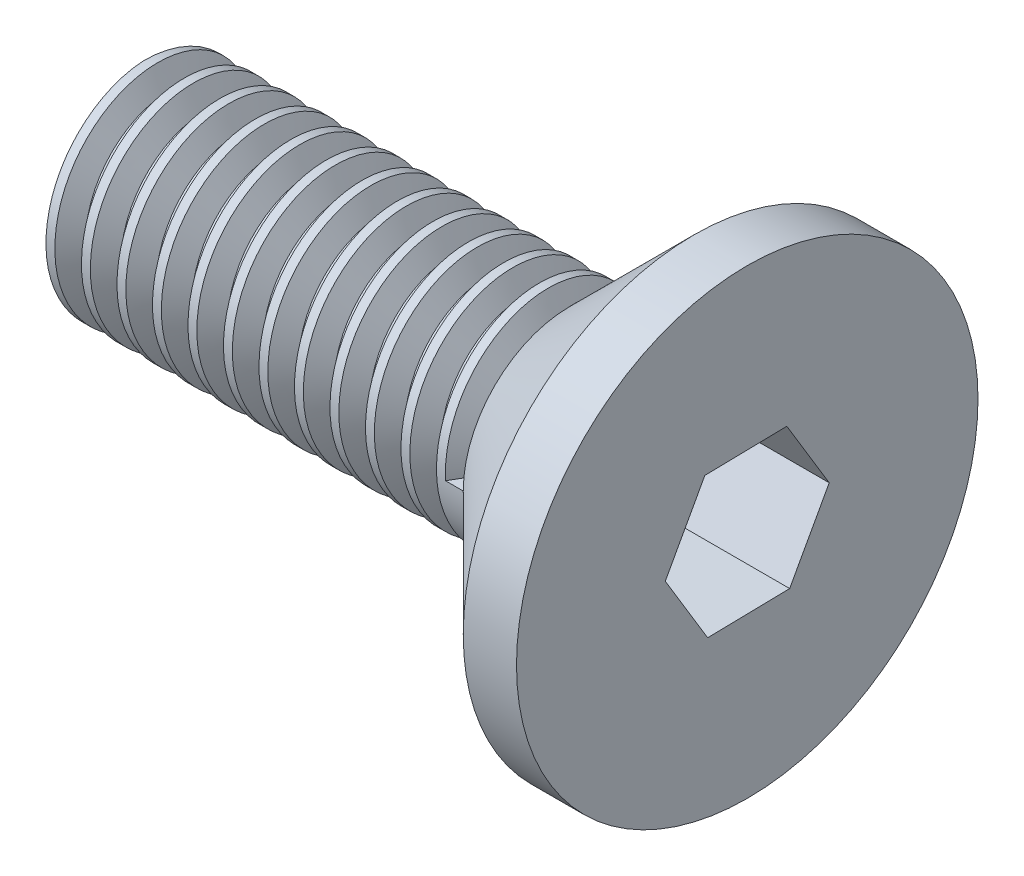
from build123d import *

# Parameters (mm, degrees)
CORTE_EXTRUS_O1_DEPTH = 4
ROSCA1_PITCH          = 1
CORTE_EXTRUS_O2_START = -1
ESBO_O22_R            = 3
CORTE_EXTRUS_O2_DEPTH = 1


with BuildPart() as part:
    # Esboço1 → Revolução1 (revolve)
    with BuildSketch(Plane(origin=(0, 0, 0), x_dir=(1, 0, 0), z_dir=(0, 1, 0))):
        Polygon((0, 0), (0, 3), (13, 3), (16.5, 6.5), (18, 6.5), (18, 0), align=None)
    revolve(axis=Axis((18, 0, 0), (-1, 0, 0)))

    # Esboço2 → Corte-extrusão1 (cut)
    with BuildSketch(Plane(origin=(18, 0, 0), x_dir=(0, 0, -1), z_dir=(1, 0, 0))):
        Polygon((-1.194677596, 1.97638022), (-2.308934276, -0.046431037), (-1.11425668, -2.022811258), (1.194677596, -1.97638022), (2.308934276, 0.046431037), (1.11425668, 2.022811258), align=None)
    extrude(amount=-CORTE_EXTRUS_O1_DEPTH, mode=Mode.SUBTRACT)

    # Rosca1: the profile of Perfil da rosca1 profile screwed along a right-hand helix of 12.5 turns, 8 arcs to a turn; built about Z, then put on its axis
    rosca1_z = Axis((0, 0, 0), (0, 0, 1))
    rosca1_corners = [(3.0003, 0, -0.000173205), (2.458734125, 0, 0.312499999), (2.458734125, 0, 0.437499999), (3.0003, 0, 0.750173202)]
    with BuildLine(mode=Mode.PRIVATE) as rosca1_profile:
        Line(rosca1_corners[0], rosca1_corners[1])
        Line(rosca1_corners[1], rosca1_corners[2])
        Line(rosca1_corners[2], rosca1_corners[3])
        Line(rosca1_corners[3], rosca1_corners[0])
    rosca1_cap = Face(rosca1_profile.wire())
    rosca1_turn_angles = [0, 22.5, 45, 67.5, 90, 112.5, 135, 157.5, 180, 202.5, 225, 247.5, 270, 292.5, 315, 337.5, 360]
    rosca1_turn_weights = [1, 0.9238795325112867, 1, 0.9238795325112867, 1, 0.9238795325112867, 1, 0.9238795325112867, 1, 0.9238795325112867, 1, 0.9238795325112867, 1, 0.9238795325112867, 1, 0.9238795325112867, 1]
    rosca1_turn_rails = [Edge.make_bspline([Vector(p[0], p[1], 0).rotate(rosca1_z, rosca1_turn_angles[k]) / rosca1_turn_weights[k] + Vector(0, 0, p[2] + ROSCA1_PITCH * rosca1_turn_angles[k] / 360) for k in range(17)], [0, 0, 0, 1, 1, 2, 2, 3, 3, 4, 4, 5, 5, 6, 6, 7, 7, 8, 8, 8], 2, rosca1_turn_weights) for p in rosca1_corners]
    rosca1_turn_sides = [Face.make_surface_from_curves(rosca1_turn_rails[p[0]], rosca1_turn_rails[p[1]]) for p in [(0, 1), (1, 2), (2, 3), (3, 0)]]
    rosca1_last_angles = [4320, 4342.5, 4365, 4387.5, 4410, 4432.5, 4455, 4477.5, 4500]
    rosca1_last_weights = [1, 0.9238795325112867, 1, 0.9238795325112867, 1, 0.9238795325112867, 1, 0.9238795325112867, 1]
    rosca1_last_rails = [Edge.make_bspline([Vector(p[0], p[1], 0).rotate(rosca1_z, rosca1_last_angles[k]) / rosca1_last_weights[k] + Vector(0, 0, p[2] + ROSCA1_PITCH * rosca1_last_angles[k] / 360) for k in range(9)], [0, 0, 0, 1, 1, 2, 2, 3, 3, 4, 4, 4], 2, rosca1_last_weights) for p in rosca1_corners]
    rosca1_last_sides = [Face.make_surface_from_curves(rosca1_last_rails[p[0]], rosca1_last_rails[p[1]]) for p in [(0, 1), (1, 2), (2, 3), (3, 0)]]
    rosca1 = Plane(origin=(0, 0, 0), x_dir=(0, 0, -1), z_dir=(1, 0, 0)) * Solid(Shell([*[p.moved(Location((0, 0, ROSCA1_PITCH * i))) for i in range(12) for p in rosca1_turn_sides], *rosca1_last_sides, rosca1_cap, rosca1_cap.rotate(rosca1_z, 4500).moved(Location((0, 0, ROSCA1_PITCH * 4500 / 360)))]))
    add(rosca1, mode=Mode.SUBTRACT)

    # Esboço22 → Corte-extrusão2 (cut)
    with BuildSketch(Plane.ZY.offset(CORTE_EXTRUS_O2_START)):
        Circle(ESBO_O22_R)
    extrude(amount=CORTE_EXTRUS_O2_DEPTH, mode=Mode.SUBTRACT)


solid = part.part
